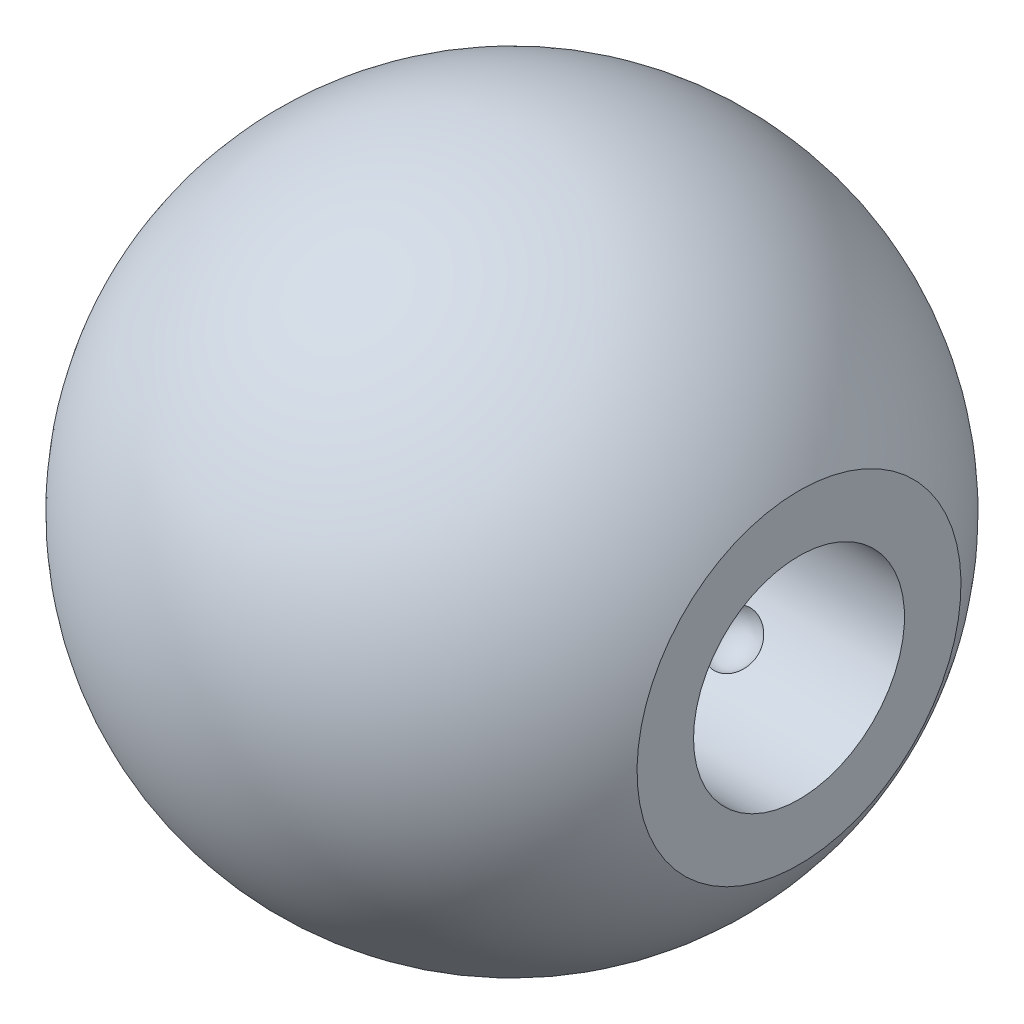
from build123d import *
from build123d.topology import SkipClean

# Parameters (mm, degrees)
SKETCH1_R           = 13.5
SKETCH1_R_2         = 11.2
BOSS_EXTRUDE1_DEPTH = 60
CIRPATTERN1_COUNT   = 8
LPATTERN1_COUNT     = 3
LPATTERN1_PITCH     = 20
FILLET1_R           = 3


with BuildPart() as part:
    # Sketch1 → Boss-Extrude1 (new body)
    with BuildSketch(Plane(origin=(0, 0, 0), x_dir=(0, 0, -1), z_dir=(1, 0, 0))):
        Circle(SKETCH1_R)
        Circle(SKETCH1_R_2, mode=Mode.SUBTRACT)
    extrude(amount=BOSS_EXTRUDE1_DEPTH)

    # Sketch2 → Cut-Revolve1 (revolve, cut)
    with BuildSketch(Plane.XY):
        with BuildLine():
            Line((8, 12.6), (8, 9.6))
            Line((8, 9.6), (11, 9.6))
            ThreePointArc((11, 9.6), (10.121320344, 11.721320344), (8, 12.6))
        make_face()
    cut_revolve1 = revolve(axis=Axis((8, 12.6, 0), (0, -1, 0)), mode=Mode.SUBTRACT)

    # CirPattern1: Cut-Revolve1 ×8 about axis
    cirpattern1_axis = Axis((0, 0, 0), (1, 0, 0))
    for i in range(1, CIRPATTERN1_COUNT):
        add(cut_revolve1.rotate(cirpattern1_axis, i * 360 / CIRPATTERN1_COUNT), mode=Mode.SUBTRACT)

    # LPattern1: Cut-Revolve1 ×3
    with Locations(*[(i * LPATTERN1_PITCH, 0, 0) for i in range(1, LPATTERN1_COUNT)]):
        add(cut_revolve1, mode=Mode.SUBTRACT)

    # LPattern1 copy 1 sketch → LPattern1 copy 1 (revolve, cut)
    with BuildSketch(Plane(origin=(20, 0, 0), x_dir=(1, 0, 0), z_dir=(0, -0.7071067811865475, 0.7071067811865476))):
        with BuildLine():
            Line((8, 12.6), (8, 9.6))
            Line((8, 9.6), (11, 9.6))
            ThreePointArc((11, 9.6), (10.121320344, 11.721320344), (8, 12.6))
        make_face()
    revolve(axis=Axis((28, 8.909545443, 8.909545443), (0, -0.7071067811865476, -0.7071067811865475)), mode=Mode.SUBTRACT)

    # LPattern1 copy 2 sketch → LPattern1 copy 2 (revolve, cut)
    with BuildSketch(Plane(origin=(40, 0, 0), x_dir=(1, 0, 0), z_dir=(0, -0.7071067811865475, 0.7071067811865476))):
        with BuildLine():
            Line((8, 12.6), (8, 9.6))
            Line((8, 9.6), (11, 9.6))
            ThreePointArc((11, 9.6), (10.121320344, 11.721320344), (8, 12.6))
        make_face()
    revolve(axis=Axis((48, 8.909545443, 8.909545443), (0, -0.7071067811865476, -0.7071067811865475)), mode=Mode.SUBTRACT)

    # LPattern1 copy 3 sketch → LPattern1 copy 3 (revolve, cut)
    with BuildSketch(Plane(origin=(20, 0, 0), x_dir=(1, 0, 0), z_dir=(0, -1, 0))):
        with BuildLine():
            Line((8, 12.6), (8, 9.6))
            Line((8, 9.6), (11, 9.6))
            ThreePointArc((11, 9.6), (10.121320344, 11.721320344), (8, 12.6))
        make_face()
    revolve(axis=Axis((28, 0, 12.6), (0, 0, -1)), mode=Mode.SUBTRACT)

    # LPattern1 copy 4 sketch → LPattern1 copy 4 (revolve, cut)
    with BuildSketch(Plane(origin=(40, 0, 0), x_dir=(1, 0, 0), z_dir=(0, -1, 0))):
        with BuildLine():
            Line((8, 12.6), (8, 9.6))
            Line((8, 9.6), (11, 9.6))
            ThreePointArc((11, 9.6), (10.121320344, 11.721320344), (8, 12.6))
        make_face()
    revolve(axis=Axis((48, 0, 12.6), (0, 0, -1)), mode=Mode.SUBTRACT)

    # LPattern1 copy 5 sketch → LPattern1 copy 5 (revolve, cut)
    with BuildSketch(Plane(origin=(20, 0, 0), x_dir=(1, 0, 0), z_dir=(0, -0.7071067811865476, -0.7071067811865475))):
        with BuildLine():
            Line((8, 12.6), (8, 9.6))
            Line((8, 9.6), (11, 9.6))
            ThreePointArc((11, 9.6), (10.121320344, 11.721320344), (8, 12.6))
        make_face()
    revolve(axis=Axis((28, -8.909545443, 8.909545443), (0, 0.7071067811865475, -0.7071067811865476)), mode=Mode.SUBTRACT)

    # LPattern1 copy 6 sketch → LPattern1 copy 6 (revolve, cut)
    with BuildSketch(Plane(origin=(40, 0, 0), x_dir=(1, 0, 0), z_dir=(0, -0.7071067811865476, -0.7071067811865475))):
        with BuildLine():
            Line((8, 12.6), (8, 9.6))
            Line((8, 9.6), (11, 9.6))
            ThreePointArc((11, 9.6), (10.121320344, 11.721320344), (8, 12.6))
        make_face()
    revolve(axis=Axis((48, -8.909545443, 8.909545443), (0, 0.7071067811865475, -0.7071067811865476)), mode=Mode.SUBTRACT)

    # LPattern1 copy 7 sketch → LPattern1 copy 7 (revolve, cut)
    with BuildSketch(Plane(origin=(20, 0, 0), x_dir=(1, 0, 0), z_dir=(0, 0, -1))):
        with BuildLine():
            Line((8, 12.6), (8, 9.6))
            Line((8, 9.6), (11, 9.6))
            ThreePointArc((11, 9.6), (10.121320344, 11.721320344), (8, 12.6))
        make_face()
    revolve(axis=Axis((28, -12.6, 0), (0, 1, 0)), mode=Mode.SUBTRACT)

    # LPattern1 copy 8 sketch → LPattern1 copy 8 (revolve, cut)
    with BuildSketch(Plane(origin=(40, 0, 0), x_dir=(1, 0, 0), z_dir=(0, 0, -1))):
        with BuildLine():
            Line((8, 12.6), (8, 9.6))
            Line((8, 9.6), (11, 9.6))
            ThreePointArc((11, 9.6), (10.121320344, 11.721320344), (8, 12.6))
        make_face()
    revolve(axis=Axis((48, -12.6, 0), (0, 1, 0)), mode=Mode.SUBTRACT)

    # LPattern1 copy 9 sketch → LPattern1 copy 9 (revolve, cut)
    with BuildSketch(Plane(origin=(20, 0, 0), x_dir=(1, 0, 0), z_dir=(0, 0.7071067811865475, -0.7071067811865477))):
        with BuildLine():
            Line((8, 12.6), (8, 9.6))
            Line((8, 9.6), (11, 9.6))
            ThreePointArc((11, 9.6), (10.121320344, 11.721320344), (8, 12.6))
        make_face()
    revolve(axis=Axis((28, -8.909545443, -8.909545443), (0, 0.7071067811865477, 0.7071067811865475)), mode=Mode.SUBTRACT)

    # LPattern1 copy 10 sketch → LPattern1 copy 10 (revolve, cut)
    with BuildSketch(Plane(origin=(40, 0, 0), x_dir=(1, 0, 0), z_dir=(0, 0.7071067811865475, -0.7071067811865477))):
        with BuildLine():
            Line((8, 12.6), (8, 9.6))
            Line((8, 9.6), (11, 9.6))
            ThreePointArc((11, 9.6), (10.121320344, 11.721320344), (8, 12.6))
        make_face()
    revolve(axis=Axis((48, -8.909545443, -8.909545443), (0, 0.7071067811865477, 0.7071067811865475)), mode=Mode.SUBTRACT)

    # LPattern1 copy 11 sketch → LPattern1 copy 11 (revolve, cut)
    with BuildSketch(Plane(origin=(20, 0, 0), x_dir=(1, 0, 0), z_dir=(0, 1, 0))):
        with BuildLine():
            Line((8, 12.6), (8, 9.6))
            Line((8, 9.6), (11, 9.6))
            ThreePointArc((11, 9.6), (10.121320344, 11.721320344), (8, 12.6))
        make_face()
    revolve(axis=Axis((28, 0, -12.6), (0, 0, 1)), mode=Mode.SUBTRACT)

    # LPattern1 copy 12 sketch → LPattern1 copy 12 (revolve, cut)
    with BuildSketch(Plane(origin=(40, 0, 0), x_dir=(1, 0, 0), z_dir=(0, 1, 0))):
        with BuildLine():
            Line((8, 12.6), (8, 9.6))
            Line((8, 9.6), (11, 9.6))
            ThreePointArc((11, 9.6), (10.121320344, 11.721320344), (8, 12.6))
        make_face()
    revolve(axis=Axis((48, 0, -12.6), (0, 0, 1)), mode=Mode.SUBTRACT)

    # LPattern1 copy 13 sketch → LPattern1 copy 13 (revolve, cut)
    with BuildSketch(Plane(origin=(20, 0, 0), x_dir=(1, 0, 0), z_dir=(0, 0.7071067811865477, 0.7071067811865474))):
        with BuildLine():
            Line((8, 12.6), (8, 9.6))
            Line((8, 9.6), (11, 9.6))
            ThreePointArc((11, 9.6), (10.121320344, 11.721320344), (8, 12.6))
        make_face()
    revolve(axis=Axis((28, 8.909545443, -8.909545443), (0, -0.7071067811865474, 0.7071067811865477)), mode=Mode.SUBTRACT)

    # LPattern1 copy 14 sketch → LPattern1 copy 14 (revolve, cut)
    with BuildSketch(Plane(origin=(40, 0, 0), x_dir=(1, 0, 0), z_dir=(0, 0.7071067811865477, 0.7071067811865474))):
        with BuildLine():
            Line((8, 12.6), (8, 9.6))
            Line((8, 9.6), (11, 9.6))
            ThreePointArc((11, 9.6), (10.121320344, 11.721320344), (8, 12.6))
        make_face()
    revolve(axis=Axis((48, 8.909545443, -8.909545443), (0, -0.7071067811865474, 0.7071067811865477)), mode=Mode.SUBTRACT)

    # Fillet1
    # the kernel refuses this fillet: 3 mm, written as the material it takes off along each edge
    with BuildSketch(Plane(origin=(0, 0, 0), x_dir=(0, 0, -1), z_dir=(0, -1, 0))) as fillet1_piece_1:
        with BuildLine():
            CenterArc((14.2, 2.917190429), FILLET1_R, 180, 76.506601178)
            Line((11.2, 2.917190429), (11.14, 2.917190429))
            Line((11.14, 2.917190429), (11.14, 0))
            Line((11.14, 0), (11.2, -0.06))
            ThreePointArc((11.2, -0.06), (12.35, -0.06), (13.486, -0.058343809))
            Line((13.486, -0.058343809), (13.5, 0))
        make_face()
    revolve(axis=Axis((0, 0, 0), (1, 0, 0)), mode=Mode.SUBTRACT)

    # Sketch3 → Revolve1 (revolve)
    with SkipClean():  # the faces are left unmerged after this step: merging them gives an invalid solid
        with BuildSketch(Plane.XY, mode=Mode.PRIVATE) as revolve1_sk:
            with BuildLine():
                Line((0, 13.5), (60, 13.5))
                Line((60, 13.5), (60, 11.2))
                Line((60, 11.2), (62.773765695, 11.2))
                Line((62.773765695, 11.2), (62.773765695, 17.2))
                ThreePointArc((62.773765695, 17.2), (30.232250284, 34.939360539), (0, 13.5))
            make_face()
        revolve(revolve1_sk.sketch.rotate(Axis((0, 0, 0), (1, 0, 0)), 90), axis=Axis((0, 0, 0), (1, 0, 0)))
    add(part.part.scale(1), mode=Mode.REPLACE)  # the faces are merged on a copy


solid = part.part
